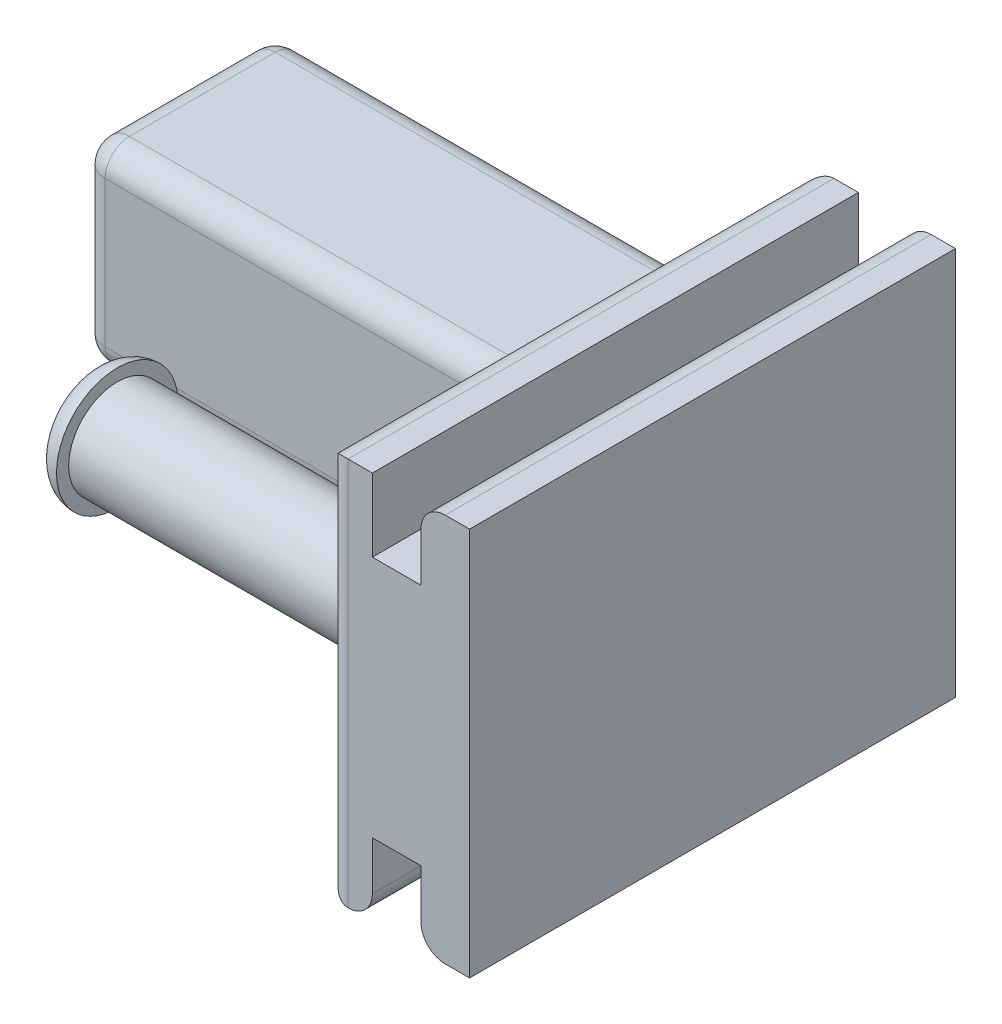
from build123d import *

# Parameters (mm, degrees)
SKETCH1_W           = 2
SKETCH1_H           = 10
BOSS_EXTRUDE1_DEPTH = 20
SKETCH2_R           = 2
BOSS_EXTRUDE2_DEPTH = 13.5
SKETCH3_R           = 2.5
BOSS_EXTRUDE3_DEPTH = 1
SKETCH4_W           = 8
SKETCH4_H           = 8
BOSS_EXTRUDE4_DEPTH = 20
FILLET1_R           = 1


with BuildPart() as part:
    # Sketch1 → Boss-Extrude1 (new body)
    with BuildSketch(Plane.XY):
        Polygon((-1, -8), (-1, -5), (-1, 5), (-1, 8), (-3, 8), (-3, -8), align=None)
        Rectangle(SKETCH1_W, SKETCH1_H)
        Polygon((1, 5), (1, -5), (1, -8), (3, -8), (3, 8), (1, 8), align=None)
    extrude(amount=BOSS_EXTRUDE1_DEPTH)

    # Sketch2 → Boss-Extrude2 (add)
    with BuildSketch(Plane.ZY.offset(3)):
        with Locations((16, 0)):
            Circle(SKETCH2_R)
    extrude(amount=BOSS_EXTRUDE2_DEPTH)

    # Sketch3 → Boss-Extrude3 (add)
    with BuildSketch(Plane.ZY.offset(16.5)):
        with Locations((16, 0)):
            Circle(SKETCH3_R)
    extrude(amount=-BOSS_EXTRUDE3_DEPTH)

    # Sketch4 → Boss-Extrude4 (add)
    with BuildSketch(Plane.ZY.offset(3)):
        with Locations((6, 0)):
            Rectangle(SKETCH4_W, SKETCH4_H)
    extrude(amount=BOSS_EXTRUDE4_DEPTH)

    # Fillet1
    fillet1_edges = [part.edges().sort_by_distance(p)[0] for p in [
        (-3, 0, 0),
        (-3, -8, 10),
        (-3, 8, 10),
        (1, 8, 10),
        (1, -8, 10),
        (-1, -8, 10),
        (-3, 0, 14),
        (-16.5, 0, 13.5),
        (-3, 0, 20),
        (-3, 0, 10),
        (-13, -4, 10),
        (-3, 4, 6),
        (-13, 4, 10),
        (-3, 0, 2),
        (-13, 4, 2),
        (-3, -4, 6),
        (-13, -4, 2),
        (-23, 0, 10),
        (-23, 4, 6),
        (-23, 0, 2),
        (-23, -4, 6),
    ]]
    fillet(fillet1_edges, radius=FILLET1_R - 0.0001)  # a hair under: the kernel refuses the full size


solid = part.part
